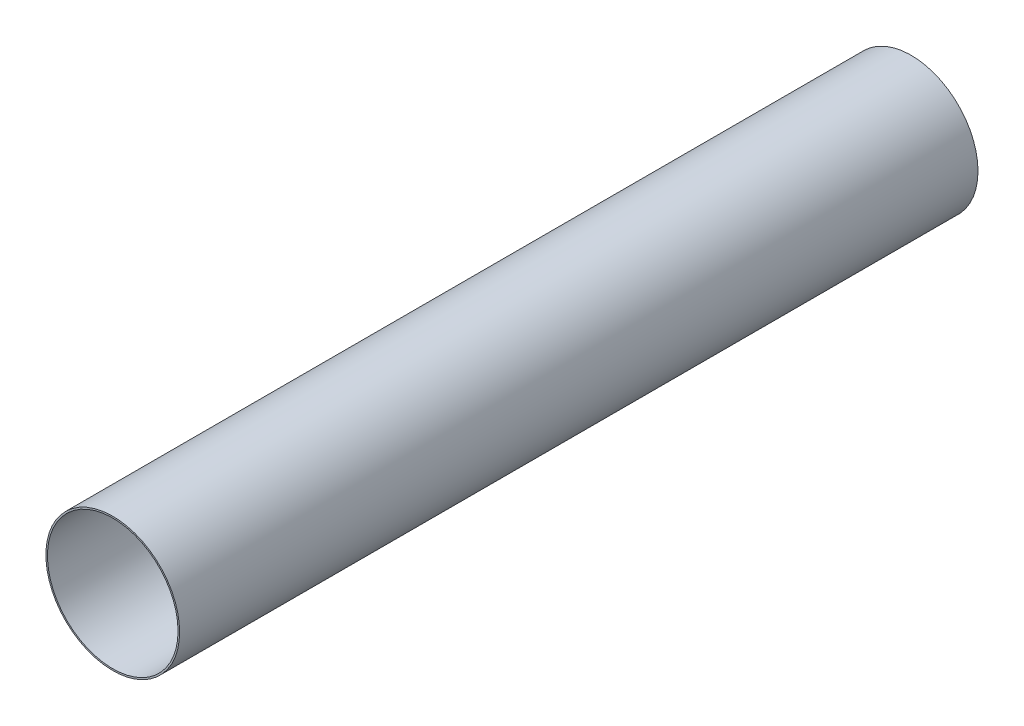
from build123d import *

# Parameters (mm, degrees)
SKETCH1_R           = 85.09991
SKETCH1_R_2         = 83.09991
BOSS_EXTRUDE1_DEPTH = 508


with BuildPart() as part:
    # Sketch1 → Boss-Extrude1 (new, symmetric)
    with BuildSketch(Plane.XY):
        Circle(SKETCH1_R)
        Circle(SKETCH1_R_2, mode=Mode.SUBTRACT)
    extrude(amount=BOSS_EXTRUDE1_DEPTH, both=True)


solid = part.part
